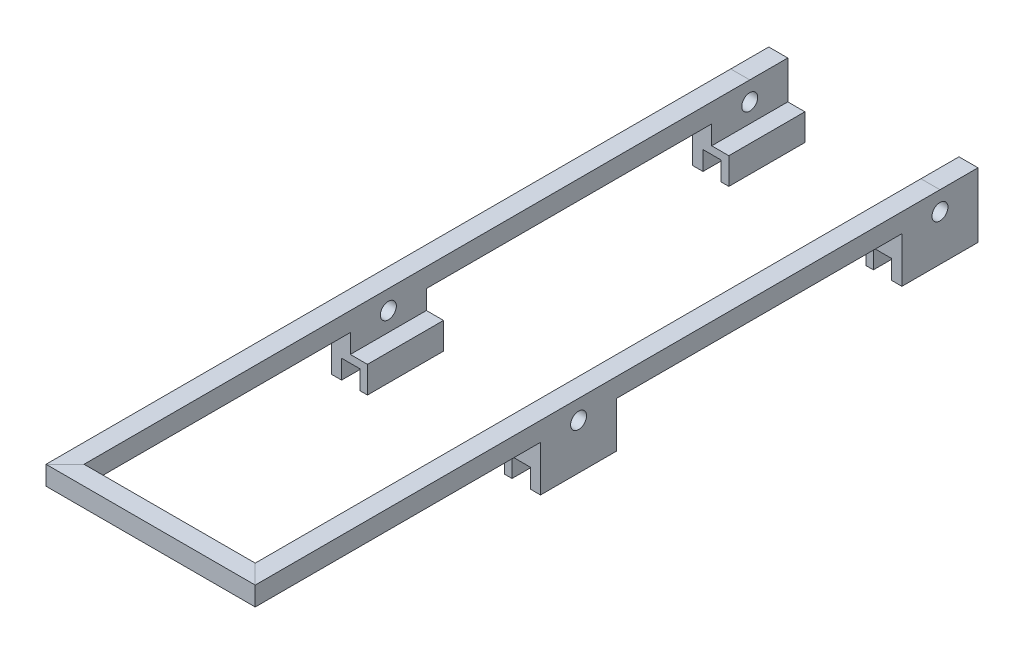
from build123d import *

# Parameters (mm, degrees)
RAIL_PROFILE_W          = 6.35
RAIL_PROFILE_H          = 6.35
BACKCLIP_DEPTH          = 12.7
FRONTCLIP_DEPTH         = 12.7
CUT_EXTRUDE1_DEPTH      = 140.989779002
CUT_EXTRUDE1_DEPTH_BACK = 140.989779002
SKETCH8_R               = 2.667


with BuildPart() as part:
    # Sweep1: sweep along a path in rail_path
    with BuildLine(Plane(origin=(0, 0, 0), x_dir=(1, 0, 0), z_dir=(0, 1, 0))) as sweep1_path:
        Line((28.575, 123.825), (28.575, 111.125))
        Line((28.575, 111.125), (28.575, -111.125))
        Line((28.575, -111.125), (-28.575, -111.125))
        Line((-28.575, -111.125), (-28.575, 111.125))
        Line((-28.575, 111.125), (-28.575, 123.825))
    # rail_profile → Sweep1 (sweep)
    with BuildSketch(Plane.XY):
        with Locations((31.75, 3.175)):
            Rectangle(RAIL_PROFILE_W, RAIL_PROFILE_H)
    sweep(path=sweep1_path.line, transition=Transition.RIGHT)

    # BackClipProfile → BackClip (add, symmetric)
    with BuildSketch(Plane(origin=(0, 0, 9.525), x_dir=(-1, 0, 0), z_dir=(0, 0, -1))):
        Polygon((-34.925, 0), (-28.575, 0), (-28.575, -6.35), (-22.86, -6.35), (-22.86, -15.24), (-25.4, -15.24), (-25.4, -8.89), (-31.496, -8.89), (-31.496, -15.24), (-34.925, -15.24), (-34.925, -6.35), align=None)
    backclip = extrude(amount=BACKCLIP_DEPTH, both=True)

    # BackClipMirror: BackClip across plane
    add(backclip.mirror(Plane(origin=(0, 0, 0), x_dir=(0, 0, 1), z_dir=(1, 0, 0))))

    # FrontClipProfile → FrontClip (add, symmetric)
    with BuildSketch(Plane(origin=(0, 0, -111.125), x_dir=(-1, 0, 0), z_dir=(0, 0, -1))):
        Polygon((-34.925, -15.24), (-31.496, -15.24), (-31.496, -8.89), (-25.4, -8.89), (-25.4, -15.24), (-22.86, -15.24), (-22.86, -6.35), (-28.575, -6.35), (-28.575, 0), (-34.925, 0), (-34.925, -6.35), align=None)
    frontclip = extrude(amount=FRONTCLIP_DEPTH, both=True)

    # FrontClipMirror: FrontClip across plane
    add(frontclip.mirror(Plane(origin=(0, 0, 0), x_dir=(0, 0, 1), z_dir=(1, 0, 0))))

    # Sketch8 → Cut-Extrude1 (cut, two sides: drawn at the far end of the back side and taken through both)
    with BuildSketch(Plane.ZY.offset(-28.575).offset(-CUT_EXTRUDE1_DEPTH_BACK)):
        with Locations((-111.125, 0)):
            Circle(SKETCH8_R)
        with Locations((9.525, 0)):
            Circle(SKETCH8_R)
    extrude(amount=CUT_EXTRUDE1_DEPTH + CUT_EXTRUDE1_DEPTH_BACK, mode=Mode.SUBTRACT)


solid = part.part
